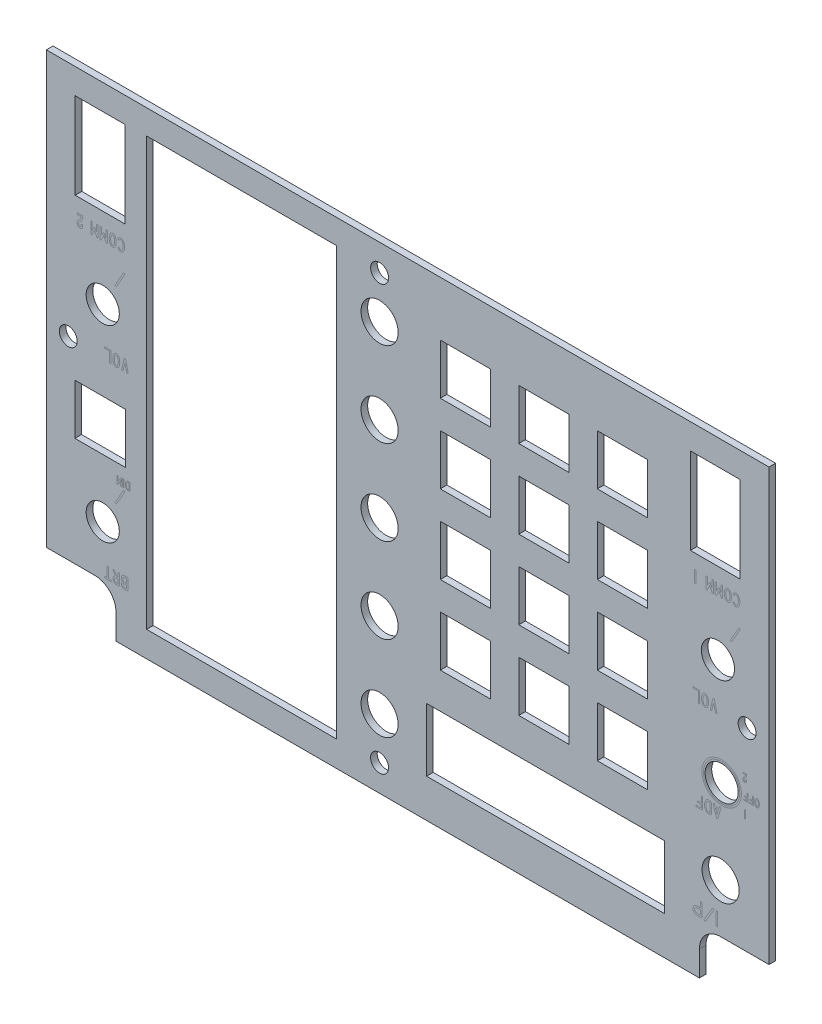
from build123d import *

# Parameters (mm, degrees)
BOSS_EXTRUDE1_DEPTH   = 1.5875
SKETCH3_R             = 4.445
SKETCH3_W             = 12.065
SKETCH3_H             = 12.065
CUT_EXTRUDE1_DEPTH    = 202.731272774
SKETCH4_R             = 3.96875
CUT_EXTRUDE2_DEPTH    = 202.731272774
SKETCH5_W             = 11.94
SKETCH5_H             = 20.64
SKETCH5_W_2           = 45.462
SKETCH5_H_2           = 102.32
SKETCH5_W_3           = 57
SKETCH5_H_3           = 15.1
CUT_EXTRUDE3_DEPTH    = 202.731272774
F_6_CLEARANCE_HOLE2_D = 4.3053


with BuildPart() as part:
    # Sketch1 → Boss-Extrude1 (new body)
    with BuildSketch(Plane.XY):
        with BuildLine():
            Line((74.93, -171.1167297), (86.51875, -171.1167297))
            Line((86.51875, -171.1167297), (86.51875, -67.9292297))
            Line((86.51875, -67.9292297), (-86.51875, -67.9292297))
            Line((-86.51875, -67.9292297), (-86.51875, -171.1167297))
            Line((-86.51875, -171.1167297), (-74.93, -171.1167297))
            ThreePointArc((-74.93, -171.1167297), (-71.337897552, -172.604627251), (-69.85, -176.1967297))
            Line((-69.85, -176.1967297), (-69.85, -182.2292297))
            Line((-69.85, -182.2292297), (69.85, -182.2292297))
            Line((69.85, -182.2292297), (69.85, -176.1967297))
            ThreePointArc((69.85, -176.1967297), (71.337897552, -172.604627251), (74.93, -171.1167297))
        make_face()
    extrude(amount=-BOSS_EXTRUDE1_DEPTH)

    # Sketch3 → Cut-Extrude1 (cut, through all)
    with BuildSketch(Plane.XY):
        with Locations((74.93, -159.3692297)):
            Circle(SKETCH3_R)
        with Locations((-6.731, -165.7192297)):
            Circle(SKETCH3_R)
        with Locations((-6.731, -145.3992297)):
            Circle(SKETCH3_R)
        with Locations((-6.731, -125.0792297)):
            Circle(SKETCH3_R)
        with Locations((-6.731, -104.7592297)):
            Circle(SKETCH3_R)
        with Locations((-6.731, -84.4392297)):
            Circle(SKETCH3_R)
        with Locations((-73.66, -139.0492297)):
            Rectangle(SKETCH3_W, SKETCH3_H)
        with Locations((13.843, -143.3672297)):
            Rectangle(SKETCH3_W, SKETCH3_H)
        with Locations((32.639, -143.3672297)):
            Rectangle(SKETCH3_W, SKETCH3_H)
        with Locations((51.435, -143.3672297)):
            Rectangle(SKETCH3_W, SKETCH3_H)
        with Locations((51.435, -124.5712297)):
            Rectangle(SKETCH3_W, SKETCH3_H)
        with Locations((32.639, -124.5712297)):
            Rectangle(SKETCH3_W, SKETCH3_H)
        with Locations((13.843, -124.5712297)):
            Rectangle(SKETCH3_W, SKETCH3_H)
        with Locations((13.843, -105.7752297)):
            Rectangle(SKETCH3_W, SKETCH3_H)
        with Locations((13.843, -86.9792297)):
            Rectangle(SKETCH3_W, SKETCH3_H)
        with Locations((32.639, -86.9792297)):
            Rectangle(SKETCH3_W, SKETCH3_H)
        with Locations((32.639, -105.7752297)):
            Rectangle(SKETCH3_W, SKETCH3_H)
        with Locations((51.435, -105.7752297)):
            Rectangle(SKETCH3_W, SKETCH3_H)
        with Locations((51.435, -86.9792297)):
            Rectangle(SKETCH3_W, SKETCH3_H)
    extrude(amount=-CUT_EXTRUDE1_DEPTH, mode=Mode.SUBTRACT)

    # Sketch4 → Cut-Extrude2 (cut, through all)
    with BuildSketch(Plane.XY):
        with Locations((-73.025, -113.9667297)):
            Circle(SKETCH4_R)
        with Locations((-73.025, -159.0517297)):
            Circle(SKETCH4_R)
        with Locations((74.295, -113.9667297)):
            Circle(SKETCH4_R)
        with Locations((75.184, -139.0492297)):
            Circle(SKETCH4_R)
    extrude(amount=-CUT_EXTRUDE2_DEPTH, mode=Mode.SUBTRACT)

    # Sketch5 → Cut-Extrude3 (cut, through all)
    with BuildSketch(Plane.XY):
        with Locations((-73.66, -84.3122297)):
            Rectangle(SKETCH5_W, SKETCH5_H)
        with Locations((73.66, -84.3122297)):
            Rectangle(SKETCH5_W, SKETCH5_H)
        with Locations((-39.799, -124.9522297)):
            Rectangle(SKETCH5_W_2, SKETCH5_H_2)
        with Locations((33.02, -165.4922297)):
            Rectangle(SKETCH5_W_3, SKETCH5_H_3)
    extrude(amount=-CUT_EXTRUDE3_DEPTH, mode=Mode.SUBTRACT)

    # #6 Clearance Hole2 (through all)
    with Locations(Plane(origin=(0, 0, 0), x_dir=(-1, 0, 0), z_dir=(0, 0, 1))):
        with Locations((-81.28, 124.6982297), (6.731, 175.8792297), (81.28, 124.6982297), (6.731, 74.2792297)):
            Hole(F_6_CLEARANCE_HOLE2_D / 2)


solid = part.part
